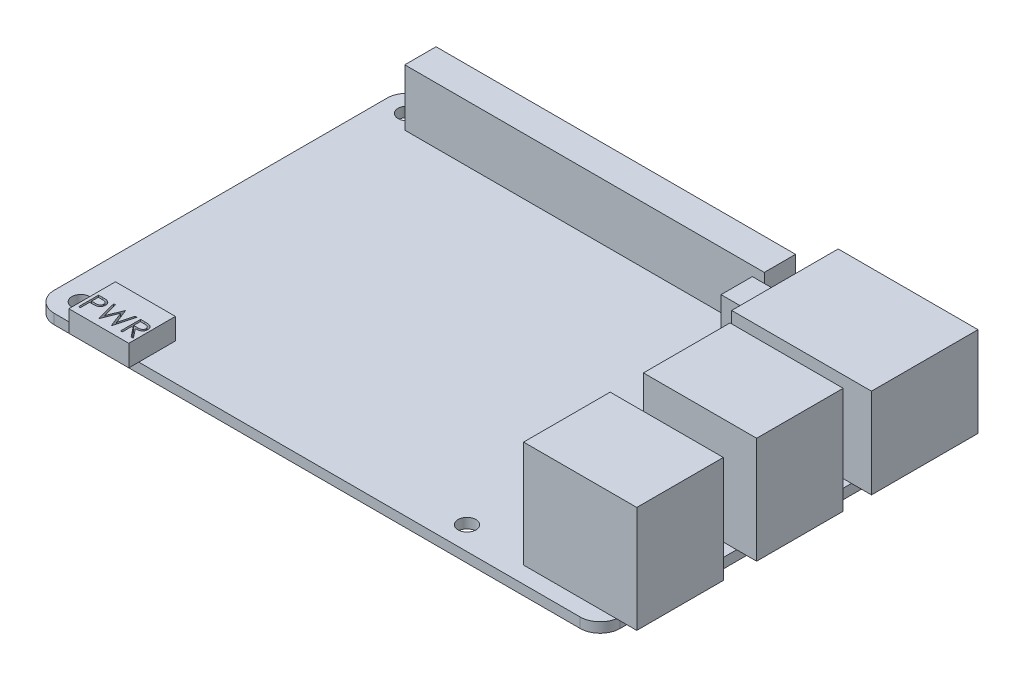
from build123d import *

# Parameters (mm, degrees)
SKETCH1_W           = 85
SKETCH1_H           = 56
SKETCH1_R           = 1.35
BOSS_EXTRUDE1_DEPTH = 1.5
FILLET1_R           = 3
SKETCH2_W           = 17
SKETCH2_H           = 13
BOSS_EXTRUDE2_DEPTH = 16
SKETCH3_W           = 21
SKETCH3_H           = 16
BOSS_EXTRUDE3_DEPTH = 13.5
SKETCH4_W           = 54
SKETCH4_H           = 4.7
SKETCH4_W_2         = 4.7
BOSS_EXTRUDE4_DEPTH = 8.5
SKETCH5_W           = 9
SKETCH5_H           = 7
BOSS_EXTRUDE5_DEPTH = 3.2
CUT_EXTRUDE1_DEPTH  = 1


with BuildPart() as part:
    # Sketch1 → Boss-Extrude1 (new body)
    with BuildSketch(Plane(origin=(0, 0, 0), x_dir=(1, 0, 0), z_dir=(0, 1, 0))):
        with Locations((42.5, 28)):
            Rectangle(SKETCH1_W, SKETCH1_H)
        with Locations((3.5, 52.5)):
            Circle(SKETCH1_R, mode=Mode.SUBTRACT)
        with Locations((3.5, 3.5)):
            Circle(SKETCH1_R, mode=Mode.SUBTRACT)
        with Locations((61.5, 3.5)):
            Circle(SKETCH1_R, mode=Mode.SUBTRACT)
        with Locations((61.5, 52.5)):
            Circle(SKETCH1_R, mode=Mode.SUBTRACT)
    extrude(amount=BOSS_EXTRUDE1_DEPTH)

    # Fillet1
    fillet1_edges = [part.edges().sort_by_distance(p)[0] for p in [
        (85, 0.75, -56),
        (85, 0.75, 0),
        (0, 0.75, -56),
        (0, 0.75, 0),
    ]]
    fillet(fillet1_edges, radius=FILLET1_R)

    # Sketch2 → Boss-Extrude2 (add)
    with BuildSketch(Plane(origin=(0, 1.5, 0), x_dir=(1, 0, 0), z_dir=(0, 1, 0))):
        with Locations((79.5, 27)):
            Rectangle(SKETCH2_W, SKETCH2_H)
        with Locations((79.5, 9)):
            Rectangle(SKETCH2_W, SKETCH2_H)
    extrude(amount=BOSS_EXTRUDE2_DEPTH)

    # Sketch3 → Boss-Extrude3 (add)
    with BuildSketch(Plane(origin=(0, 1.5, 0), x_dir=(1, 0, 0), z_dir=(0, 1, 0))):
        with Locations((77.5, 45.75)):
            Rectangle(SKETCH3_W, SKETCH3_H)
    extrude(amount=BOSS_EXTRUDE3_DEPTH)

    # Sketch4 → Boss-Extrude4 (add)
    with BuildSketch(Plane(origin=(0, 1.5, 0), x_dir=(1, 0, 0), z_dir=(0, 1, 0))):
        with Locations((32.5, 52.5)):
            Rectangle(SKETCH4_W, SKETCH4_H)
        with Locations((61.5, 46.36)):
            Rectangle(SKETCH4_W_2, SKETCH4_H)
    extrude(amount=BOSS_EXTRUDE4_DEPTH)

    # Sketch5 → Boss-Extrude5 (add)
    with BuildSketch(Plane(origin=(0, 1.5, 0), x_dir=(1, 0, 0), z_dir=(0, 1, 0))):
        with Locations((11.2, 2)):
            Rectangle(SKETCH5_W, SKETCH5_H)
    extrude(amount=BOSS_EXTRUDE5_DEPTH)

    # Sketch6 → Cut-Extrude1 (cut)
    # profile 1 of 3: a face of its own
    with BuildSketch(Plane(origin=(0, 4.7, 0), x_dir=(1, 0, 0), z_dir=(0, 1, 0))):
        with BuildLine():
            Line((7.161538462, 2.5), (7.749879808, 2.5))
            add(Edge.make_bspline(
                [(7.749879808, 2.5), (7.790346299, 2.499955518), (7.867881893, 2.499870287), (7.979066226, 2.497286219), (8.080045996, 2.493834769), (8.170603465, 2.489050289), (8.251017264, 2.483396069), (8.32092352, 2.475465749), (8.380871712, 2.467185496), (8.416791525, 2.458767148), (8.433173077, 2.454927885)],
                knots=[0, 0, 0, 0, 1.415646017, 2.712440637, 3.8905458, 4.950247383, 5.884950622, 6.709939814, 7.411656543, 8, 8, 8, 8], degree=3))
            add(Edge.make_bspline(
                [(8.433173077, 2.454927885), (8.453910392, 2.449251928), (8.494896372, 2.43803376), (8.553954409, 2.415564855), (8.610143419, 2.388922999), (8.663656184, 2.358559622), (8.713835112, 2.323171995), (8.761428862, 2.284194609), (8.806017416, 2.24072755), (8.847350038, 2.193258344), (8.885308436, 2.142583879), (8.917991021, 2.087947682), (8.945357215, 2.030269422), (8.968828591, 1.969589218), (8.985721552, 1.905397512), (8.998447466, 1.83814033), (9.006524861, 1.767824881), (9.007298485, 1.719773566), (9.007692308, 1.6953125)],
                knots=[0, 0, 0, 0, 0.999701418, 1.975846123, 2.934577507, 3.890451536, 4.834027766, 5.787354733, 6.749476667, 7.726910423, 8.712836071, 9.690891519, 10.682875813, 11.679750201, 12.712814741, 13.765529915, 14.8625177, 16, 16, 16, 16], degree=3))
            add(Edge.make_bspline(
                [(9.007692308, 1.6953125), (9.007331086, 1.670645834), (9.006624333, 1.622383837), (8.998141803, 1.551778589), (8.986715924, 1.484305684), (8.969147022, 1.420114726), (8.946136445, 1.359586923), (8.919143257, 1.301797295), (8.886585945, 1.247729005), (8.849176091, 1.197185762), (8.807560439, 1.150120122), (8.761915063, 1.106873156), (8.712424241, 1.067698009), (8.659245257, 1.032506857), (8.601859672, 1.00211576), (8.541137826, 0.974895213), (8.476551927, 0.952034304), (8.431858343, 0.940008537), (8.409134615, 0.933894231)],
                knots=[0, 0, 0, 0, 1.121902311, 2.195077645, 3.232258892, 4.234102512, 5.217864754, 6.176164875, 7.132989551, 8.084763148, 9.034132444, 9.988522005, 10.94243251, 11.903244335, 12.886203696, 13.894208494, 14.929344452, 16, 16, 16, 16], degree=3))
            add(Edge.make_bspline(
                [(8.409134615, 0.933894231), (8.390339758, 0.92989739), (8.349149734, 0.921138081), (8.281313115, 0.911359403), (8.202331356, 0.903012888), (8.112312259, 0.89675477), (8.011336626, 0.891397312), (7.899349834, 0.887138946), (7.776132054, 0.884799071), (7.690185273, 0.884678391), (7.6453125, 0.884615385)],
                knots=[0, 0, 0, 0, 0.601384939, 1.31797006, 2.144135048, 3.087295005, 4.142315834, 5.309527816, 6.595305764, 8, 8, 8, 8], degree=3))
            Line((7.6453125, 0.884615385), (7.430769231, 0.884615385))
            Line((7.430769231, 0.884615385), (7.430769231, -0.5))
            Line((7.430769231, -0.5), (7.161538462, -0.5))
            Line((7.161538462, -0.5), (7.161538462, 2.5))
        make_face()
        with BuildLine():
            Line((7.430769231, 2.192307692), (7.430769231, 1.192307692))
            Line((7.430769231, 1.192307692), (7.956009615, 1.185697115))
            add(Edge.make_bspline(
                [(7.956009615, 1.185697115), (7.981655266, 1.185683861), (8.031163666, 1.185658273), (8.102680429, 1.189074179), (8.169031246, 1.193017493), (8.230012311, 1.198791142), (8.285651112, 1.206952219), (8.336040423, 1.215190852), (8.380789522, 1.227109734), (8.433160267, 1.243158079), (8.491517422, 1.270528893), (8.555003892, 1.31025737), (8.608807251, 1.360897977), (8.655365791, 1.417836118), (8.692313687, 1.481178229), (8.71936168, 1.548951603), (8.735254101, 1.620461188), (8.737385124, 1.669393879), (8.738461538, 1.694110577)],
                knots=[0, 0, 0, 0, 1.160613943, 2.240541288, 3.23993089, 4.169200891, 5.011653406, 5.7853311, 6.478053781, 7.106038997, 8.262395093, 9.384106736, 10.481365981, 11.59014053, 12.70357646, 13.786202915, 14.881775077, 16, 16, 16, 16], degree=3))
            add(Edge.make_bspline(
                [(8.738461538, 1.694110577), (8.73737927, 1.718229303), (8.735227854, 1.766174345), (8.719237115, 1.836441854), (8.692366274, 1.903501029), (8.655117764, 1.966049388), (8.609911082, 2.022782648), (8.557368788, 2.0720659), (8.497614564, 2.111684502), (8.442030366, 2.137255887), (8.39265792, 2.15286898), (8.349773383, 2.163793129), (8.301352805, 2.172515077), (8.247380423, 2.179577508), (8.188274565, 2.185623332), (8.123527438, 2.189725598), (8.053384315, 2.192126846), (8.00468954, 2.192245951), (7.979447115, 2.192307692)],
                knots=[0, 0, 0, 0, 1.120700087, 2.227813068, 3.331159281, 4.466773991, 5.599788987, 6.693661531, 7.80175334, 8.91857717, 9.525282508, 10.207424825, 10.974604443, 11.810962634, 12.737642355, 13.736264703, 14.826523623, 16, 16, 16, 16], degree=3))
            Line((7.979447115, 2.192307692), (7.430769231, 2.192307692))
        make_face(mode=Mode.SUBTRACT)
    # profile 2 of 3: a face of its own
    with BuildSketch(Plane(origin=(0, 4.7, 0), x_dir=(1, 0, 0), z_dir=(0, 1, 0))):
        Polygon((9.430769231, 2.5), (9.709014423, 2.5), (10.296153846, 0.299879808), (11.169350962, 2.5), (11.208413462, 2.5), (12.065384615, 0.314903846), (12.655528846, 2.5), (12.930769231, 2.5), (12.121875, -0.5), (12.083413462, -0.5), (11.180769231, 1.794471154), (10.267307692, -0.5), (10.228846154, -0.5), align=None)
    # profile 3 of 3: a face of its own
    with BuildSketch(Plane(origin=(0, 4.7, 0), x_dir=(1, 0, 0), z_dir=(0, 1, 0))):
        with BuildLine():
            Line((13.469230769, 2.5), (14.069591346, 2.5))
            add(Edge.make_bspline(
                [(14.069591346, 2.5), (14.109655171, 2.499866641), (14.186582152, 2.499610576), (14.296787812, 2.498182779), (14.396925324, 2.494090474), (14.486942329, 2.490568831), (14.566837176, 2.484147167), (14.636854854, 2.47800947), (14.69667288, 2.469974903), (14.73288361, 2.462513112), (14.749278846, 2.459134615)],
                knots=[0, 0, 0, 0, 1.410062039, 2.707475311, 3.878576406, 4.937260626, 5.877586885, 6.699081471, 7.410979367, 8, 8, 8, 8], degree=3))
            add(Edge.make_bspline(
                [(14.749278846, 2.459134615), (14.771227381, 2.453711674), (14.814656229, 2.442981476), (14.877184857, 2.420301818), (14.936768564, 2.394056426), (14.993159842, 2.36323038), (15.046076234, 2.327594854), (15.096063358, 2.287765035), (15.14334804, 2.243958859), (15.186018009, 2.195071852), (15.226251482, 2.143783415), (15.26018459, 2.088323052), (15.289435859, 2.030327457), (15.312724873, 1.969206813), (15.331477422, 1.905553866), (15.344699913, 1.83879204), (15.352629502, 1.76922549), (15.353436807, 1.721775854), (15.353846154, 1.697716346)],
                knots=[0, 0, 0, 0, 1.027469482, 2.033020251, 3.019912614, 3.986113645, 4.951240523, 5.91722682, 6.890402269, 7.87763091, 8.8651537, 9.85103654, 10.82876324, 11.815024772, 12.821070561, 13.842952187, 14.906261191, 16, 16, 16, 16], degree=3))
            add(Edge.make_bspline(
                [(15.353846154, 1.697716346), (15.352587013, 1.657743399), (15.350130102, 1.579745827), (15.32722287, 1.466550786), (15.289700139, 1.360959945), (15.237994463, 1.263106255), (15.172149198, 1.17489713), (15.093013663, 1.097419597), (15.00054371, 1.032585386), (14.914461439, 0.98762584), (14.838420696, 0.958831918), (14.775820714, 0.938572182), (14.707534733, 0.922919069), (14.634217018, 0.908896098), (14.555562456, 0.898308932), (14.471759565, 0.890554708), (14.382748578, 0.885708381), (14.321600804, 0.884986662), (14.290144231, 0.884615385)],
                knots=[0, 0, 0, 0, 1.260483769, 2.459530307, 3.627416485, 4.787058657, 5.939039949, 7.08810263, 8.267026773, 9.491475466, 10.141966685, 10.831826277, 11.566392101, 12.351337768, 13.187381173, 14.07005841, 15.007169909, 16, 16, 16, 16], degree=3))
            Line((14.290144231, 0.884615385), (15.392307692, -0.5))
            Line((15.392307692, -0.5), (15.059375, -0.5))
            Line((15.059375, -0.5), (13.957211538, 0.884615385))
            Line((13.957211538, 0.884615385), (13.738461538, 0.884615385))
            Line((13.738461538, 0.884615385), (13.738461538, -0.5))
            Line((13.738461538, -0.5), (13.469230769, -0.5))
            Line((13.469230769, -0.5), (13.469230769, 2.5))
        make_face()
        with BuildLine():
            Line((13.738461538, 2.192307692), (13.738461538, 1.192307692))
            Line((13.738461538, 1.192307692), (14.287740385, 1.188100962))
            add(Edge.make_bspline(
                [(14.287740385, 1.188100962), (14.313386132, 1.188089616), (14.363094896, 1.188067625), (14.435009751, 1.191490861), (14.501969847, 1.195385134), (14.563719063, 1.201341716), (14.620284985, 1.209018349), (14.671639339, 1.218620907), (14.717865955, 1.229808389), (14.771778988, 1.247124068), (14.831981729, 1.274557798), (14.897408694, 1.314471083), (14.953124984, 1.364673185), (15.000197437, 1.422079005), (15.038022664, 1.485195789), (15.064690139, 1.553266963), (15.081612233, 1.624574047), (15.083608129, 1.673583854), (15.084615385, 1.698317308)],
                knots=[0, 0, 0, 0, 1.146690395, 2.22261258, 3.21895312, 4.145990853, 4.996080663, 5.770904154, 6.481378293, 7.121626537, 8.300444488, 9.431385265, 10.535395872, 11.636531494, 12.74115979, 13.810798291, 14.895190096, 16, 16, 16, 16], degree=3))
            add(Edge.make_bspline(
                [(15.084615385, 1.698317308), (15.083584995, 1.722442942), (15.081543139, 1.770251147), (15.064872766, 1.840241927), (15.036681868, 1.906299313), (14.998691378, 1.968154586), (14.952406388, 2.024302359), (14.898133977, 2.072342776), (14.837358096, 2.111985175), (14.780554211, 2.137317501), (14.729782029, 2.152848804), (14.685699464, 2.163778373), (14.635889625, 2.172559346), (14.580110661, 2.179594827), (14.518600692, 2.185641922), (14.451048705, 2.189714875), (14.377902893, 2.192126758), (14.327205524, 2.192245977), (14.300961538, 2.192307692)],
                knots=[0, 0, 0, 0, 1.101028733, 2.181837193, 3.264309656, 4.369019818, 5.486613113, 6.575447106, 7.666700264, 8.788928104, 9.402425223, 10.0903467, 10.862060571, 11.710948788, 12.657782767, 13.684531032, 14.801375019, 16, 16, 16, 16], degree=3))
            Line((14.300961538, 2.192307692), (13.738461538, 2.192307692))
        make_face(mode=Mode.SUBTRACT)
    extrude(amount=-CUT_EXTRUDE1_DEPTH, mode=Mode.SUBTRACT)


solid = part.part
